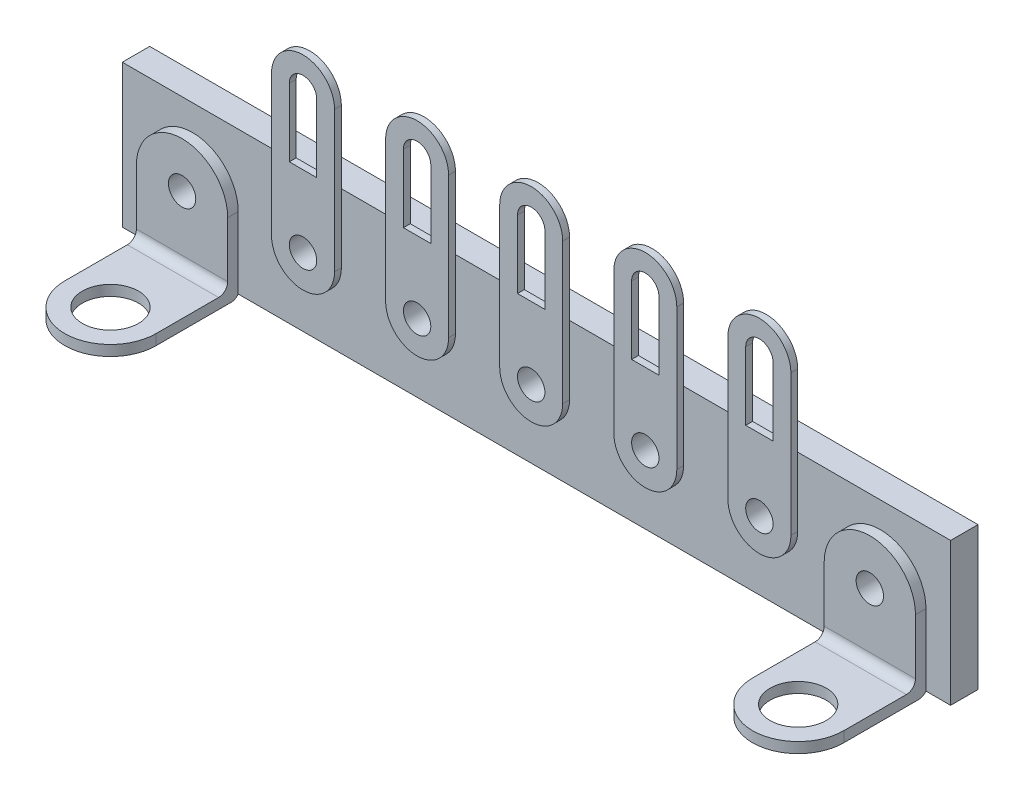
from build123d import *

# Parameters (mm, degrees)
SKETCH1_W           = 46.101
SKETCH1_H           = 7.9502
BASE_EXTRUDE_DEPTH  = 1.524
BOSS_EXTRUDE1_DEPTH = 0.5842
SKETCH3_R           = 1.5621
BOSS_EXTRUDE2_DEPTH = 0.5842
FILLET1_R           = 0.508
SKETCH4_R           = 0.762
CUT_EXTRUDE1_DEPTH  = 48.234733554
MIRROR1_START       = -1
MIRROR1_OUTLINE_R   = 0.762
MIRROR1_DEPTH       = 2.524
MIRROR1_START_2     = 1.524
MIRROR1_2_OUTLINE_R = 0.762
MIRROR1_2_DEPTH     = 0.5842
MIRROR1_START_3     = 1.9304
MIRROR1_3_OUTLINE_W = 5.08
MIRROR1_3_OUTLINE_H = 0.5842
MIRROR1_3_DEPTH     = 2.6034999
MIRROR1_START_4     = 39.6494
MIRROR1_4_DEPTH     = 5.08
MIRROR1_START_5     = -0.2032
MIRROR1_5_OUTLINE_R = 1.5621
MIRROR1_5_DEPTH     = 0.5842
BOSS_EXTRUDE3_DEPTH = 0.381
SKETCH6_R           = 0.762
CUT_EXTRUDE2_DEPTH  = 2.54
LPATTERN1_COUNT     = 5
LPATTERN1_PITCH     = 6.35


with BuildPart() as part:
    # Sketch1 → Base-Extrude (new body)
    with BuildSketch(Plane.XY):
        with Locations((23.0505, 3.9751)):
            Rectangle(SKETCH1_W, SKETCH1_H)
    extrude(amount=BASE_EXTRUDE_DEPTH)

    # Sketch2 → Boss-Extrude1 (add)
    with BuildSketch(Plane.XY.offset(1.524)):
        with BuildLine():
            Line((6.4516, 3.9751), (6.4516, -0.2032))
            Line((6.4516, -0.2032), (1.3716, -0.2032))
            Line((1.3716, -0.2032), (1.3716, 3.9751))
            ThreePointArc((1.3716, 3.9751), (3.9116, 6.5151), (6.4516, 3.9751))
        make_face()
    extrude(amount=BOSS_EXTRUDE1_DEPTH)

    # Sketch3 → Boss-Extrude2 (add)
    with BuildSketch(Plane(origin=(0, -0.2032, 0), x_dir=(-1, 0, 0), z_dir=(0, 1, 0))):
        with BuildLine():
            Line((-1.3716, 6.096), (-1.3716, 1.524))
            Line((-1.3716, 1.524), (-6.4516, 1.524))
            Line((-6.4516, 1.524), (-6.4516, 6.096))
            ThreePointArc((-6.4516, 6.096), (-3.9116, 8.636), (-1.3716, 6.096))
        make_face()
        with Locations(Location((-3.9116, 6.096, 0), (0, 0, 90))):
            Circle(SKETCH3_R, mode=Mode.SUBTRACT)
    extrude(amount=BOSS_EXTRUDE2_DEPTH)

    # Fillet1
    # the kernel refuses this fillet: 0.508 mm, written as the material it adds along each edge
    with BuildSketch(Plane(origin=(6.4516, 0.381, 2.1082), x_dir=(0, 1, 0), z_dir=(-1, 0, 0))) as fillet1_piece_1:
        with BuildLine():
            CenterArc((FILLET1_R, -FILLET1_R), FILLET1_R, 90, 90)
            Line((0, -FILLET1_R), (0, 0))
            Line((0, 0), (FILLET1_R, 0))
        make_face()
    extrude(amount=5.08)
    # the kernel refuses this fillet: 0.508 mm, written as the material it takes off along each edge
    with BuildSketch(Plane(origin=(7.4676, -0.2032, 1.524), x_dir=(0, 1.0, 2.6098982991759982e-11), z_dir=(-1, 0, 0))) as fillet1_2_piece_1:
        with BuildLine():
            CenterArc((0.508, -0.4064), FILLET1_R, 126.869897647, 53.130102355)
            Line((0, -0.4064), (0, 0))
            Line((0, 0), (0.2032, 0))
        make_face()
    extrude(amount=7.112, mode=Mode.SUBTRACT)

    # Sketch4 → Cut-Extrude1 (cut, through all)
    with BuildSketch(Plane.XY.offset(2.1082)):
        with Locations((3.9116, 3.9751)):
            Circle(SKETCH4_R)
    extrude(amount=-CUT_EXTRUDE1_DEPTH, mode=Mode.SUBTRACT)

    # Mirror1: read off the stored shape, not the designer's step
    # Mirror1 outline → Mirror1 (cut)
    with BuildSketch(Plane.XY.offset(MIRROR1_START)):
        with Locations((42.1894, 3.9751)):
            Circle(MIRROR1_OUTLINE_R)
    extrude(amount=MIRROR1_DEPTH, mode=Mode.SUBTRACT)

    # Mirror1 2 outline → Mirror1 2 (add)
    with BuildSketch(Plane.XY.offset(MIRROR1_START_2)):
        with BuildLine():
            Line((39.6494, 3.9751), (39.6494, 0.381))
            Line((39.6494, 0.381), (44.7294, 0.381))
            Line((44.7294, 0.381), (44.7294, 3.9751))
            ThreePointArc((44.7294, 3.9751), (42.1894, 6.5151), (39.6494, 3.9751))
        make_face()
        with Locations((42.1894, 3.9751)):
            Circle(MIRROR1_2_OUTLINE_R, mode=Mode.SUBTRACT)
    extrude(amount=MIRROR1_2_DEPTH)

    # Mirror1 3 outline → Mirror1 3 (add)
    with BuildSketch(Plane.XY.offset(MIRROR1_START_3)):
        with Locations((42.1894, 0.0889)):
            Rectangle(MIRROR1_3_OUTLINE_W, MIRROR1_3_OUTLINE_H)
    extrude(amount=MIRROR1_3_DEPTH)

    # Mirror1 4 outline → Mirror1 4 (add)
    with BuildSketch(Plane.YZ.offset(MIRROR1_START_4)):
        with BuildLine():
            Line((0.381, 1.9304), (-0.2032, 1.9304))
            ThreePointArc((-0.2032, 1.9304), (-0.149569013, 1.703215493), (0, 1.524))
            Line((0, 1.524), (0.381, 1.524))
            Line((0.381, 1.524), (0.381, 1.9304))
        make_face()
        with BuildLine():
            ThreePointArc((0.889, 2.1082), (0.529789755, 2.256989755), (0.381, 2.6162))
            Line((0.381, 2.6162), (0.381, 2.1082))
            Line((0.381, 2.1082), (0.889, 2.1082))
        make_face()
    extrude(amount=MIRROR1_4_DEPTH)

    # Mirror1 5 outline → Mirror1 5 (add)
    with BuildSketch(Plane(origin=(0, 0, 0), x_dir=(1, 0, 0), z_dir=(0, 1, 0)).offset(MIRROR1_START_5)):
        with BuildLine():
            Line((39.6494, -2.6162), (39.6494, -6.096))
            ThreePointArc((39.6494, -6.096), (42.1894, -8.636), (44.7294, -6.096))
            Line((44.7294, -6.096), (44.7294, -2.6162))
            Line((44.7294, -2.6162), (39.6494, -2.6162))
        make_face()
        with Locations((42.1894, -6.096)):
            Circle(MIRROR1_5_OUTLINE_R, mode=Mode.SUBTRACT)
    extrude(amount=MIRROR1_5_DEPTH)

    # Sketch5 → Boss-Extrude3 (add)
    with BuildSketch(Plane.XY.offset(1.524)):
        with BuildLine():
            Line((37.592, 11.9634508), (37.592, 4.128262))
            ThreePointArc((37.592, 4.128262), (35.8394, 2.375662), (34.0868, 4.128262))
            Line((34.0868, 4.128262), (34.0868, 11.9634508))
            ThreePointArc((34.0868, 11.9634508), (35.8394, 13.7160508), (37.592, 11.9634508))
        make_face()
        with BuildLine():
            Line((35.0774, 8.177194519), (36.6014, 8.177194519))
            Line((36.6014, 8.177194519), (36.6014, 11.9634508))
            ThreePointArc((36.6014, 11.9634508), (35.8394, 12.7254508), (35.0774, 11.9634508))
            Line((35.0774, 11.9634508), (35.0774, 8.177194519))
        make_face(mode=Mode.SUBTRACT)
    boss_extrude3 = extrude(amount=BOSS_EXTRUDE3_DEPTH)

    # Sketch6 → Cut-Extrude2 (cut)
    with BuildSketch(Plane.XY.offset(1.905)):
        with Locations((35.8394, 4.1783)):
            Circle(SKETCH6_R)
    cut_extrude2 = extrude(amount=-CUT_EXTRUDE2_DEPTH, mode=Mode.SUBTRACT)

    # LPattern1: Boss-Extrude3, Cut-Extrude2 ×5
    with Locations(*[(-i * LPATTERN1_PITCH, 0, 0) for i in range(1, LPATTERN1_COUNT)]):
        add(boss_extrude3)
        add(cut_extrude2, mode=Mode.SUBTRACT)


solid = part.part
